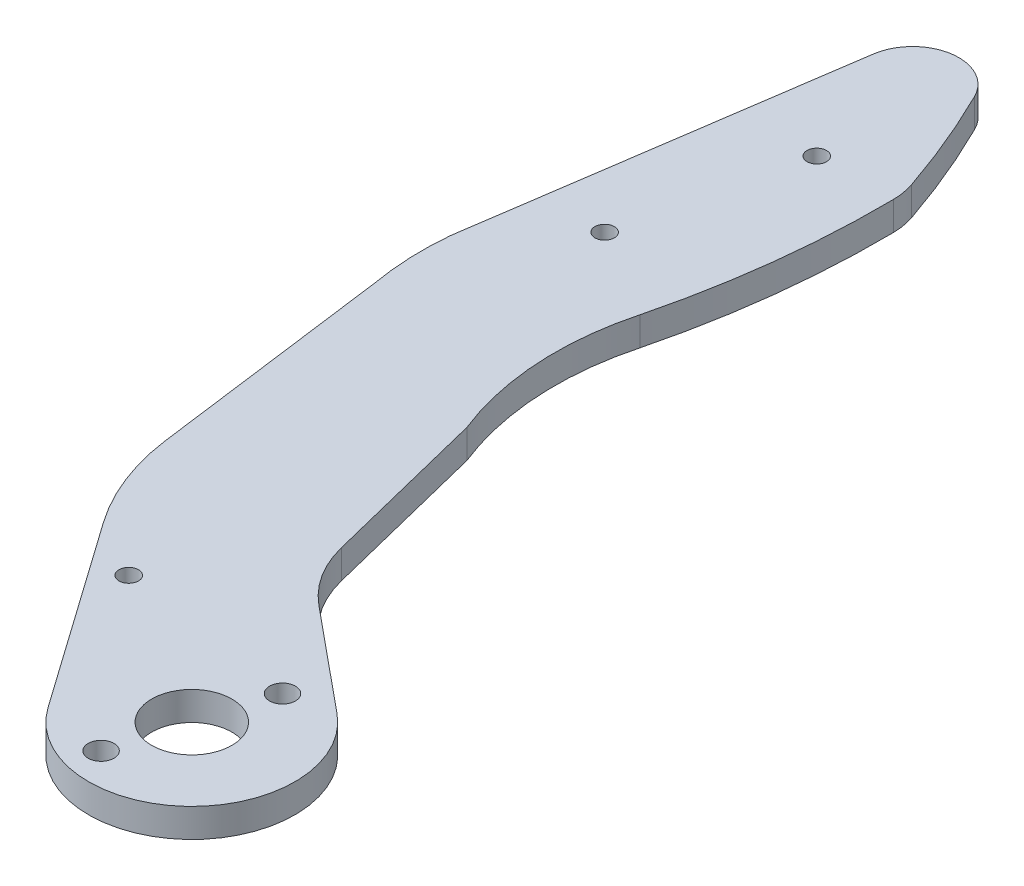
from build123d import *

# Parameters (mm, degrees)
SKETCH1_R                = 7
SKETCH1_R_2              = 1.7
BOSS_EXTRUDE2_DEPTH      = 5
CUT_EXTRUDE1_REACH       = 176.989
SKETCH3_R                = 1.7
M4_CLEARANCE_HOLE1_D     = 4.5
M4_CLEARANCE_HOLE1_DEPTH = 10.1
M4_CLEARANCE_HOLE1_TIP   = 1.351936393


with BuildPart() as part:
    # Sketch1 → Boss-Extrude2 (new body)
    with BuildSketch(Plane(origin=(0, 0, 0), x_dir=(1, 0, 0), z_dir=(0, 1, 0))):
        with BuildLine():
            Line((11.446477506, 13.891657666), (-6.606953629, 28.767362089))
            ThreePointArc((-6.606953629, 28.767362089), (-10.806918693, 33.53614027), (-13.298943796, 39.38171661))
            Line((-13.298943796, 39.38171661), (-20.530174792, 68.49716437))
            ThreePointArc((-20.530174792, 68.49716437), (-24.08112857, 84.393152776), (-22.456551163, 100.599709115))
            ThreePointArc((-22.456551163, 100.599709115), (-18.824269383, 120.221092129), (-17.76802696, 140.147870449))
            ThreePointArc((-17.76802696, 140.147870449), (-17.943181625, 142.067888002), (-18.417828761, 143.936539027))
            ThreePointArc((-18.417828761, 143.936539027), (-22.023480215, 153.489775682), (-26.256294904, 162.782156045))
            ThreePointArc((-26.256294904, 162.782156045), (-34.757388509, 167.168565439), (-41.482617684, 160.365590178))
            Line((-41.482617684, 160.365590178), (-50.932711484, 96.056215067))
            ThreePointArc((-50.932711484, 96.056215067), (-51.118515181, 89.191813761), (-50.383474997, 82.364351257))
            Line((-50.383474997, 82.364351257), (-44.819294227, 40.249739786))
            ThreePointArc((-44.819294227, 40.249739786), (-42.41581584, 30.91866257), (-37.850662253, 22.433081678))
            Line((-37.850662253, 22.433081678), (-14.709041721, -10.375167067))
            ThreePointArc((-14.709041721, -10.375167067), (12.242580486, -13.195424322), (11.446477506, 13.891657666))
        make_face()
        Circle(SKETCH1_R, mode=Mode.SUBTRACT)
        with Locations((-27.673284612, 16.679008328)):
            Circle(SKETCH1_R_2, mode=Mode.SUBTRACT)
    extrude(amount=BOSS_EXTRUDE2_DEPTH)

    # Sketch3 → Cut-Extrude1 (cut, up to next)
    with BuildSketch(Plane(origin=(0, 5, 0), x_dir=(1, 0, 0), z_dir=(0, 1, 0)), mode=Mode.PRIVATE) as cut_extrude1_sk1:
        with Locations((-31, 140)):
            Circle(SKETCH3_R)
    cut_extrude1_tool1 = extrude(cut_extrude1_sk1.sketch, amount=-CUT_EXTRUDE1_REACH, mode=Mode.PRIVATE) & part.part
    # Sketch3 → Cut-Extrude1 (cut, up to next)
    with BuildSketch(Plane(origin=(0, 5, 0), x_dir=(1, 0, 0), z_dir=(0, 1, 0)), mode=Mode.PRIVATE) as cut_extrude1_sk2:
        with Locations((-38, 110)):
            Circle(SKETCH3_R)
    cut_extrude1_tool2 = extrude(cut_extrude1_sk2.sketch, amount=-CUT_EXTRUDE1_REACH, mode=Mode.PRIVATE) & part.part
    add(cut_extrude1_tool1.solids().sort_by_distance((-31, 5, -140))[0], mode=Mode.SUBTRACT)
    add(cut_extrude1_tool2.solids().sort_by_distance((-38, 5, -110))[0], mode=Mode.SUBTRACT)

    # M4 Clearance Hole1
    with Locations(Plane(origin=(-3.585359684, 5, 12.235509631), x_dir=(0, 0, 1), z_dir=(0, 1, 0))):
        with Locations((0, 0), (-24.471019262, 7.170719368)):
            Hole(M4_CLEARANCE_HOLE1_D / 2, depth=M4_CLEARANCE_HOLE1_DEPTH)
            with Locations((0, 0, -(M4_CLEARANCE_HOLE1_DEPTH + M4_CLEARANCE_HOLE1_TIP / 2))):  # 118° drill point
                Cone(0, M4_CLEARANCE_HOLE1_D / 2, M4_CLEARANCE_HOLE1_TIP, mode=Mode.SUBTRACT)


solid = part.part
